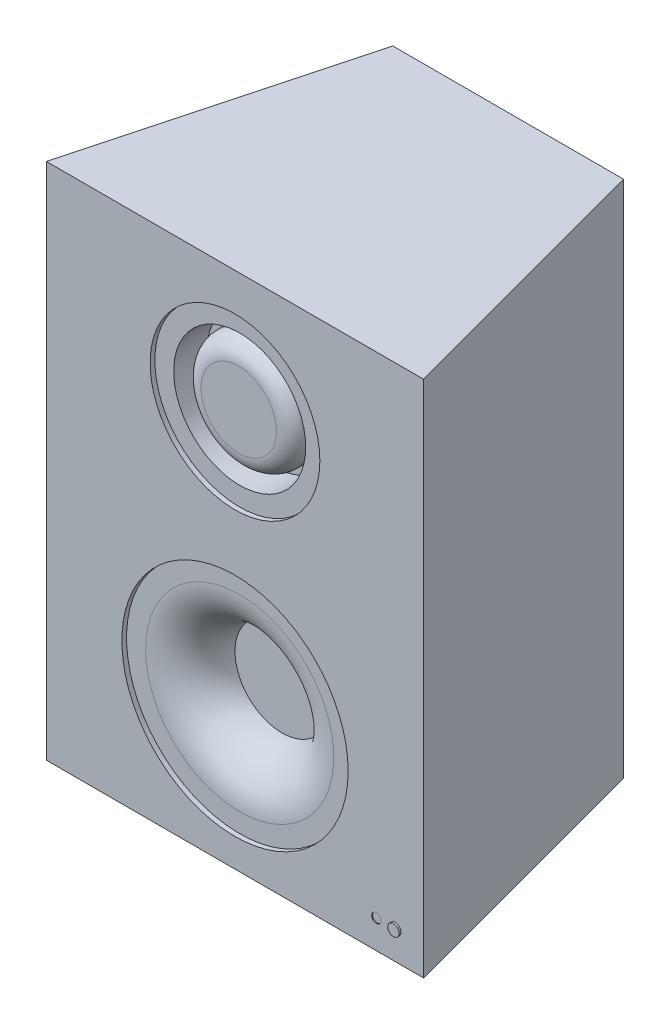
from build123d import *

# Parameters (mm, degrees)
BOSS_EXTRUDE1_DEPTH = 69.85
SKETCH3_R           = 11.43
SKETCH3_R_2         = 8.89
CUT_EXTRUDE1_DEPTH  = 0.635
SKETCH3_4_R         = 8.89
SKETCH3_4_R_2       = 7.62
CUT_EXTRUDE2_DEPTH  = 5.08
SKETCH3_5_R         = 7.62
CUT_EXTRUDE3_DEPTH  = 0.508
FILLET1_R           = 2.54
SKETCH3_6_R         = 15.24
SKETCH3_6_R_2       = 6.35
CUT_EXTRUDE4_DEPTH  = 0.635
SKETCH3_7_R         = 6.35
CUT_EXTRUDE5_DEPTH  = 6.35
FILLET5_R           = 6.35
SKETCH7_R           = 0.764119483
BOSS_EXTRUDE3_DEPTH = 0.254
SKETCH7_4_R         = 0.635
CUT_EXTRUDE6_DEPTH  = 0.127
SKETCH8_R           = 3.175
CUT_EXTRUDE7_DEPTH  = 2.54
SCALE1_SCALE        = 2


with BuildPart() as part:
    # Sketch1 → Boss-Extrude1 (new body)
    with BuildSketch(Plane(origin=(0, 0, 0), x_dir=(1, 0, 0), z_dir=(0, 1, 0))):
        Polygon((-25.4, 0), (25.4, 0), (15.538994382, 36.801773982), (-15.538994382, 36.801773982), align=None)
    extrude(amount=BOSS_EXTRUDE1_DEPTH)

    # Sketch3 → Cut-Extrude1 (cut)
    with BuildSketch(Plane.XY):
        with Locations((0, 53.34)):
            Circle(SKETCH3_R)
        with Locations((0, 53.34)):
            Circle(SKETCH3_R_2, mode=Mode.SUBTRACT)
    extrude(amount=-CUT_EXTRUDE1_DEPTH, mode=Mode.SUBTRACT)

    # Sketch3<4> → Cut-Extrude2 (cut)
    with BuildSketch(Plane.XY):
        with Locations((0, 53.34)):
            Circle(SKETCH3_4_R)
        with Locations((0, 53.34)):
            Circle(SKETCH3_4_R_2, mode=Mode.SUBTRACT)
    extrude(amount=-CUT_EXTRUDE2_DEPTH, mode=Mode.SUBTRACT)

    # Sketch3<5> → Cut-Extrude3 (cut)
    with BuildSketch(Plane.XY):
        with Locations((0, 53.34)):
            Circle(SKETCH3_5_R)
    extrude(amount=-CUT_EXTRUDE3_DEPTH, mode=Mode.SUBTRACT)

    # Fillet1
    fillet1_edges = [part.edges().sort_by_distance(p)[0] for p in [
        (-7.62, 53.34, -0.508),
    ]]
    fillet(fillet1_edges, radius=FILLET1_R)

    # Sketch3<6> → Cut-Extrude4 (cut)
    with BuildSketch(Plane.XY):
        with Locations((0, 19.05)):
            Circle(SKETCH3_6_R)
        with Locations((0, 19.05)):
            Circle(SKETCH3_6_R_2, mode=Mode.SUBTRACT)
    extrude(amount=-CUT_EXTRUDE4_DEPTH, mode=Mode.SUBTRACT)

    # Sketch3<7> → Cut-Extrude5 (cut)
    with BuildSketch(Plane.XY):
        with Locations((0, 19.05)):
            Circle(SKETCH3_7_R)
    extrude(amount=-CUT_EXTRUDE5_DEPTH, mode=Mode.SUBTRACT)

    # Fillet5
    # the kernel refuses this fillet: 6.35 mm, written as the material it takes off along each edge
    with BuildSketch(Plane(origin=(0, 19.05, -0.635), x_dir=(1, 0, 0), z_dir=(0, -1, 0))) as fillet5_piece_1:
        with BuildLine():
            CenterArc((12.668170226, -6.35), FILLET5_R, 90, 84.260829523)
            Line((6.35, -5.715), (6.223636595, -5.7023))
            ThreePointArc((6.223636595, -5.7023), (6.223, -2.8575), (6.223, 0))
            Line((6.223, 0), (6.35, 0.127))
            Line((6.35, 0.127), (12.668170226, 0.127))
            Line((12.668170226, 0.127), (12.668170226, 0))
        make_face()
    revolve(axis=Axis((0, 19.05, -0.635), (0, 0, 1)), mode=Mode.SUBTRACT)

    # Sketch7 → Boss-Extrude3 (add)
    with BuildSketch(Plane.XY):
        with Locations(Location((21.59, 3.81, 0), (0, 0, 180))):
            Circle(SKETCH7_R)
    extrude(amount=BOSS_EXTRUDE3_DEPTH)

    # Sketch7<4> → Cut-Extrude6 (cut)
    with BuildSketch(Plane.XY):
        with Locations((19.05, 3.81)):
            Circle(SKETCH7_4_R)
    extrude(amount=-CUT_EXTRUDE6_DEPTH, mode=Mode.SUBTRACT)

    # Sketch8 → Cut-Extrude7 (cut)
    with BuildSketch(Plane.XZ):
        with Locations(Location((0, -27.94, 0), (0, 0, 270))):
            Circle(SKETCH8_R)
    extrude(amount=-CUT_EXTRUDE7_DEPTH, mode=Mode.SUBTRACT)


with BuildPart() as part_1:
    # Scale1: scaled about (6.7929e-05, 35.092141807, -17.231977993)
    add(part.part.scale(SCALE1_SCALE).moved(Location((-6.7929e-05, -35.092141807, 17.231977993))))


solid = part_1.part
